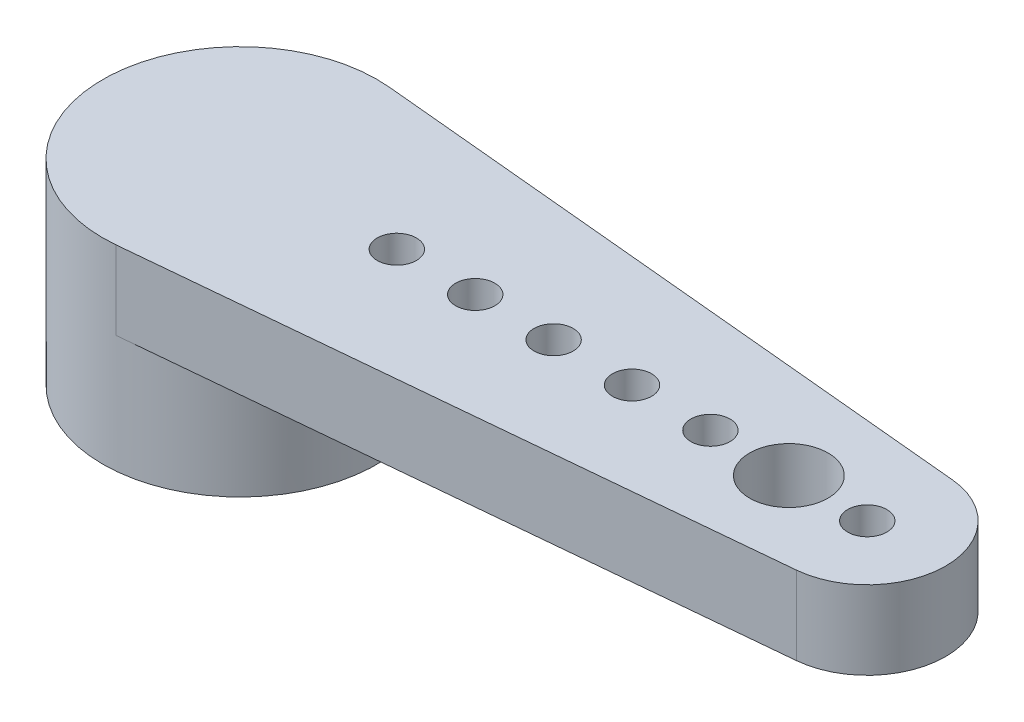
from build123d import *

# Parameters (mm, degrees)
SKETCH1_R           = 3.5
SKETCH1_R_2         = 2.4
BOSS_EXTRUDE1_DEPTH = 3
SKETCH2_R           = 1
SKETCH2_R_2         = 0.5
BOSS_EXTRUDE2_DEPTH = 2


with BuildPart() as part:
    # Sketch1 → Boss-Extrude1 (new body)
    with BuildSketch(Plane(origin=(0, 0, 0), x_dir=(1, 0, 0), z_dir=(0, 1, 0))):
        Circle(SKETCH1_R)
        Circle(SKETCH1_R_2, mode=Mode.SUBTRACT)
    extrude(amount=BOSS_EXTRUDE1_DEPTH)

    # Sketch2 → Boss-Extrude2 (add)
    with BuildSketch(Plane(origin=(0, 3, 0), x_dir=(1, 0, 0), z_dir=(0, 1, 0))):
        with BuildLine():
            Line((16.1875, 1.99119154), (0.328125, 3.484585195))
            ThreePointArc((0.328125, 3.484585195), (-3.5, 0), (0.328125, -3.484585195))
            Line((0.328125, -3.484585195), (16.1875, -1.99119154))
            ThreePointArc((16.1875, -1.99119154), (18, 0), (16.1875, 1.99119154))
        make_face()
        with Locations((14, 0)):
            Circle(SKETCH2_R, mode=Mode.SUBTRACT)
        with Locations((4, 0)):
            Circle(SKETCH2_R_2, mode=Mode.SUBTRACT)
        with Locations((6, 0)):
            Circle(SKETCH2_R_2, mode=Mode.SUBTRACT)
        with Locations((8, 0)):
            Circle(SKETCH2_R_2, mode=Mode.SUBTRACT)
        with Locations((10, 0)):
            Circle(SKETCH2_R_2, mode=Mode.SUBTRACT)
        with Locations((12, 0)):
            Circle(SKETCH2_R_2, mode=Mode.SUBTRACT)
        with Locations((16, 0)):
            Circle(SKETCH2_R_2, mode=Mode.SUBTRACT)
    extrude(amount=BOSS_EXTRUDE2_DEPTH)


solid = part.part
